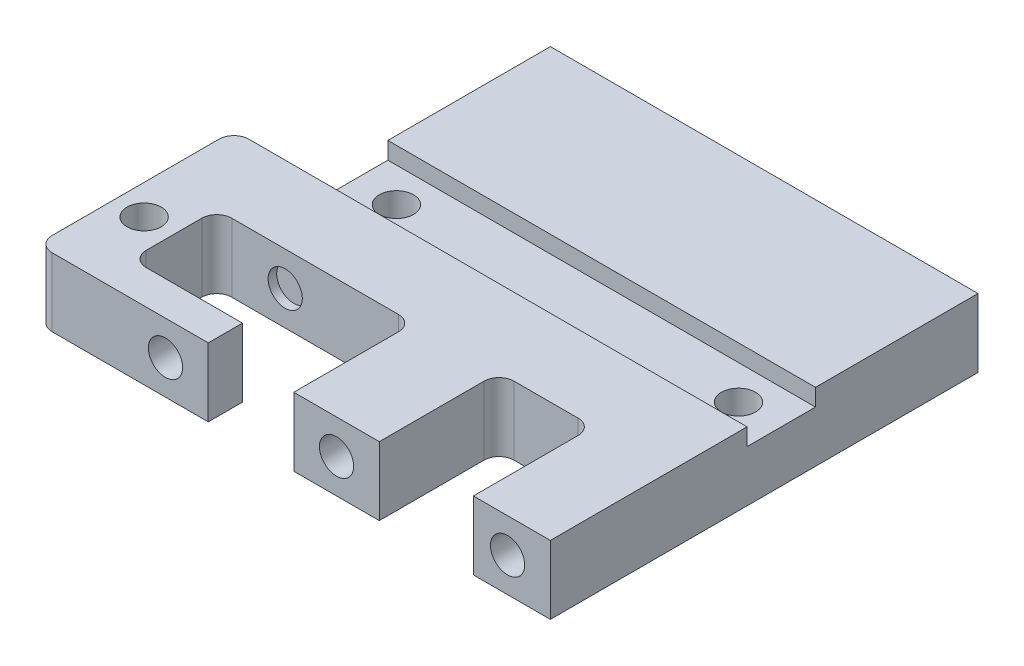
from build123d import *

# Parameters (mm, degrees)
BOSS_EXTRU_1_DEPTH      = 8
ESQUISSE3_R             = 2
ENL_V_MAT_EXTRU_2_DEPTH = 10
ESQUISSE4_R             = 2
ENL_V_MAT_EXTRU_3_DEPTH = 10
CHANFREIN1_SIZE         = 2.5
ESQUISSE5_W             = 50
ESQUISSE5_H             = 8
ENL_V_MAT_EXTRU_4_DEPTH = 2
ESQUISSE6_W             = 23
ESQUISSE6_H             = 8
BOSS_EXTRU_2_DEPTH      = 10
ESQUISSE7_W             = 4
ESQUISSE7_H             = 8
BOSS_EXTRU_3_DEPTH      = 10
ENL_V_MAT_EXTRU_5_REACH = 83.809
ENL_V_START             = -15
ESQUISSE2_R             = 2
ENL_V_MAT_EXTRU_1_DEPTH = 15
CONG_1_R                = 1.75
ENL_V_MAT_EXTRU_7_REACH = 83.809
ESQUISSE10_R            = 2


with BuildPart() as part:
    # Esquisse1 → Boss.-Extru.1 (new body)
    with BuildSketch(Plane(origin=(0, 0, 0), x_dir=(1, 0, 0), z_dir=(0, 1, 0))):
        Polygon((-57.148145082, 46.041666667), (-7.148145082, 46.041666667), (-7.148145082, 16.041666667), (-7.148145082, -3.958333333), (-16.148145082, -3.958333333), (-16.148145082, 10.041666667), (-27.148145082, 10.041666667), (-27.148145082, -3.958333333), (-37.148145082, -3.958333333), (-37.148145082, 10.041666667), (-48.148145082, 10.041666667), (-57.148145082, 10.041666667), align=None)
    extrude(amount=BOSS_EXTRU_1_DEPTH)

    # Esquisse3 → Enlèv. mat.-Extru.2 (cut)
    with BuildSketch(Plane(origin=(0, 0, -46.041666667), x_dir=(-1, 0, 0), z_dir=(0, 0, -1))):
        with Locations((12.148145082, 4)):
            Circle(ESQUISSE3_R)
        with Locations((52.148145082, 4)):
            Circle(ESQUISSE3_R)
    extrude(amount=-ENL_V_MAT_EXTRU_2_DEPTH, mode=Mode.SUBTRACT)

    # Esquisse4 → Enlèv. mat.-Extru.3 (cut)
    with BuildSketch(Plane(origin=(0, 8, 0), x_dir=(1, 0, 0), z_dir=(0, 1, 0))):
        with Locations((-52.148145082, 23.041666667)):
            Circle(ESQUISSE4_R)
        with Locations((-12.148145082, 23.041666667)):
            Circle(ESQUISSE4_R)
    extrude(amount=-ENL_V_MAT_EXTRU_3_DEPTH, mode=Mode.SUBTRACT)

    # Chanfrein1
    chanfrein1_edges = [part.edges().sort_by_distance(p)[0] for p in [
        (-54.148145082, 0, -23.041666667),
        (-14.148145082, 0, -23.041666667),
    ]]
    chamfer(chanfrein1_edges, length=CHANFREIN1_SIZE)

    # Esquisse5 → Enlèv. mat.-Extru.4 (cut)
    with BuildSketch(Plane(origin=(0, 8, 0), x_dir=(1, 0, 0), z_dir=(0, 1, 0))):
        with Locations((-32.148145082, 23.041666667)):
            Rectangle(ESQUISSE5_W, ESQUISSE5_H)
    extrude(amount=-ENL_V_MAT_EXTRU_4_DEPTH, mode=Mode.SUBTRACT)

    # Esquisse6 → Boss.-Extru.2 (add)
    with BuildSketch(Plane.ZY.offset(57.148145082)):
        with Locations((-7.541666667, 4)):
            Rectangle(ESQUISSE6_W, ESQUISSE6_H)
    extrude(amount=BOSS_EXTRU_2_DEPTH)

    # Esquisse7 → Boss.-Extru.3 (add)
    with BuildSketch(Plane(origin=(-57.148145082, 0, 0), x_dir=(0, 0, -1), z_dir=(1, 0, 0))):
        with Locations((-1.958333333, 4)):
            Rectangle(ESQUISSE7_W, ESQUISSE7_H)
    extrude(amount=BOSS_EXTRU_3_DEPTH)

    # Esquisse8 → Enlèv. mat.-Extru.5 (cut, up to next)
    with BuildSketch(Plane(origin=(0, 8, 0), x_dir=(1, 0, 0), z_dir=(0, 1, 0)), mode=Mode.PRIVATE) as enl_v_mat_extru_5_sk1:
        with BuildLine():
            Line((-60.148145082, 8.291666667), (-60.148145082, 1.791666667))
            ThreePointArc((-60.148145082, 1.791666667), (-59.635581949, 0.5542298), (-58.398145082, 0.041666667))
            Line((-58.398145082, 0.041666667), (-54.642660859, 0.041666667))
            Line((-54.642660859, 0.041666667), (-54.642660859, 10.041666667))
            Line((-54.642660859, 10.041666667), (-58.398145082, 10.041666667))
            ThreePointArc((-58.398145082, 10.041666667), (-59.635581949, 9.529103534), (-60.148145082, 8.291666667))
        make_face()
    enl_v_mat_extru_5_tool1 = extrude(enl_v_mat_extru_5_sk1.sketch, amount=-ENL_V_MAT_EXTRU_5_REACH, mode=Mode.PRIVATE) & part.part
    add(enl_v_mat_extru_5_tool1.solids().sort_by_distance((-57.337635, 8, -5.041667))[0], mode=Mode.SUBTRACT)

    # Esquisse2 → Enlèv. mat.-Extru.1 (cut)
    with BuildSketch(Plane.XY.offset(3.958333333).offset(ENL_V_START)):
        with Locations((-52.148145082, 4)):
            Circle(ESQUISSE2_R)
        with Locations((-12.148145082, 4)):
            Circle(ESQUISSE2_R)
        with Locations((-32.148145082, 4)):
            Circle(ESQUISSE2_R)
    extrude(amount=ENL_V_MAT_EXTRU_1_DEPTH, mode=Mode.SUBTRACT)

    # Congé1
    cong_1_edges = [part.edges().sort_by_distance(p)[0] for p in [
        (-16.148145082, 4, -10.041666667),
        (-27.148145082, 4, -10.041666667),
        (-37.148145082, 4, -10.041666667),
        (-57.148145082, 3, -19.041666667),
        (-67.148145082, 4, 3.958333333),
        (-67.148145082, 4, -19.041666667),
    ]]
    fillet(cong_1_edges, radius=CONG_1_R)

    # Esquisse10 → Enlèv. mat.-Extru.7 (cut, up to next)
    with BuildSketch(Plane(origin=(0, 8, 0), x_dir=(1, 0, 0), z_dir=(0, 1, 0)), mode=Mode.PRIVATE) as enl_v_mat_extru_7_sk1:
        with Locations((-63.648145082, 5.041666667)):
            Circle(ESQUISSE10_R)
    enl_v_mat_extru_7_tool1 = extrude(enl_v_mat_extru_7_sk1.sketch, amount=-ENL_V_MAT_EXTRU_7_REACH, mode=Mode.PRIVATE) & part.part
    add(enl_v_mat_extru_7_tool1.solids().sort_by_distance((-63.648145, 8, -5.041667))[0], mode=Mode.SUBTRACT)


solid = part.part
